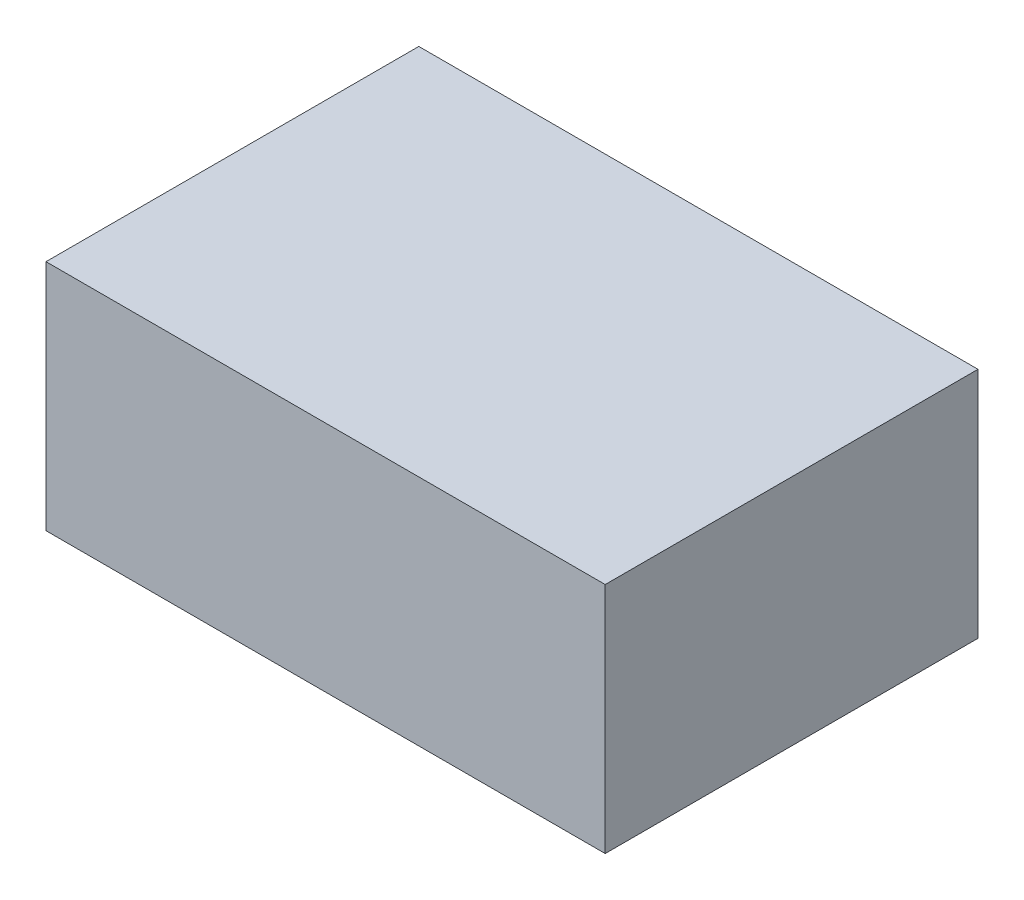
from build123d import *

# Parameters (mm, degrees)
SKETCH1_W           = 304.8
SKETCH1_H           = 203.2
BOSS_EXTRUDE1_DEPTH = 63.5


with BuildPart() as part:
    # Sketch1 → Boss-Extrude1 (new, symmetric)
    with BuildSketch(Plane(origin=(0, 0, 0), x_dir=(1, 0, 0), z_dir=(0, 1, 0))):
        Rectangle(SKETCH1_W, SKETCH1_H)
    extrude(amount=BOSS_EXTRUDE1_DEPTH, both=True)


solid = part.part
